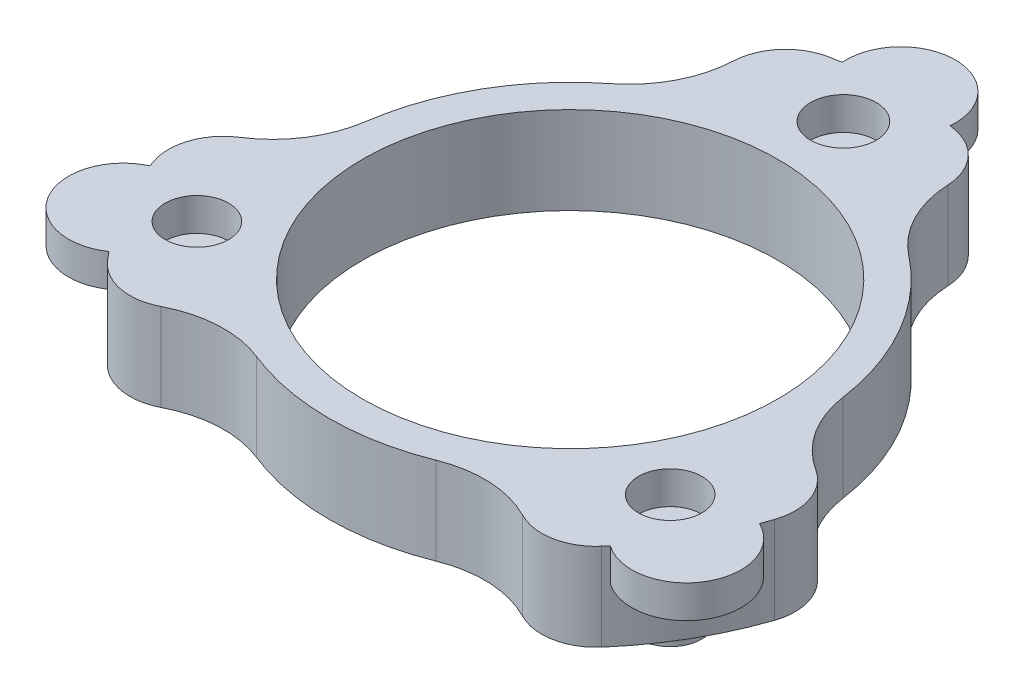
from build123d import *

# Parameters (mm, degrees)
SKETCH1_R                = 19
BOSS_EXTRUDE1_DEPTH      = 3.5
SKETCH2_R                = 30
SKETCH2_R_2              = 19
SKETCH2_R_3              = 2.8
BOSS_EXTRUDE2_DEPTH      = 8
BOSS_EXTRUDE3_DEPTH      = 2
BOSS_EXTRUDE3_DEPTH_BACK = 8
SKETCH4_R                = 2.9
SKETCH5_R                = 5
BOSS_EXTRUDE4_DEPTH      = 3
CUT_EXTRUDE1_START       = -10
SKETCH3_R                = 19
CUT_EXTRUDE1_DEPTH       = 10
SKETCH6_R                = 3
SKETCH6_R_2              = 2.9
CUT_EXTRUDE2_DEPTH       = 3
CUT_EXTRUDE3_START       = -13
CUT_EXTRUDE3_DEPTH       = 13
FILLET1_R                = 10
FILLET2_R                = 5


with BuildPart() as part:
    # Sketch1 → Boss-Extrude1 (new body)
    with BuildSketch(Plane(origin=(0, 0, 0), x_dir=(1, 0, 0), z_dir=(0, 1, 0))):
        with Locations(Location((0, 0, 0), (0, 0, 270))):
            Circle(SKETCH1_R)
    extrude(amount=BOSS_EXTRUDE1_DEPTH)

    # Sketch2 → Boss-Extrude2 (add)
    with BuildSketch(Plane(origin=(0, 0, 0), x_dir=(1, 0, 0), z_dir=(0, 1, 0))):
        with Locations(Location((0, 0, 0), (0, 0, 270))):
            Circle(SKETCH2_R)
        with Locations(Location((0, 0, 0), (0, 0, 270))):
            Circle(SKETCH2_R_2, mode=Mode.SUBTRACT)
        with Locations(Location((0, 25, 0), (0, 0, 270))):
            Circle(SKETCH2_R_3, mode=Mode.SUBTRACT)
        with Locations(Location((21.650635095, -12.5, 0), (0, 0, 270))):
            Circle(SKETCH2_R_3, mode=Mode.SUBTRACT)
        with Locations(Location((-21.650635095, -12.5, 0), (0, 0, 270))):
            Circle(SKETCH2_R_3, mode=Mode.SUBTRACT)
    extrude(amount=BOSS_EXTRUDE2_DEPTH)

    # Sketch4 → Boss-Extrude3 (add, two sides: drawn at the far end of the back side and taken through both)
    with BuildSketch(Plane.XZ.offset(-BOSS_EXTRUDE3_DEPTH_BACK)):
        with Locations(Location((-21.650635095, 12.5, 0), (0, 0, 270))):
            Circle(SKETCH4_R)
        with Locations(Location((21.650635095, 12.5, 0), (0, 0, 270))):
            Circle(SKETCH4_R)
        with Locations(Location((0, -25, 0), (0, 0, 270))):
            Circle(SKETCH4_R)
    extrude(amount=BOSS_EXTRUDE3_DEPTH + BOSS_EXTRUDE3_DEPTH_BACK)

    # Sketch5 → Boss-Extrude4 (add)
    with BuildSketch(Plane(origin=(0, 8, 0), x_dir=(1, 0, 0), z_dir=(0, 1, 0))):
        with Locations((-26.103110985, -14.7860609)):
            Circle(SKETCH5_R)
        with Locations((0.246451131, 29.99898768)):
            Circle(SKETCH5_R)
        with Locations((25.856659853, -15.212926781)):
            Circle(SKETCH5_R)
    extrude(amount=-BOSS_EXTRUDE4_DEPTH)

    # Sketch3 → Cut-Extrude1 (cut)
    with BuildSketch(Plane(origin=(0, 3.5, 0), x_dir=(1, 0, 0), z_dir=(0, 1, 0)).offset(CUT_EXTRUDE1_START)):
        with Locations(Location((0, 0, 0), (0, 0, 270))):
            Circle(SKETCH3_R)
    extrude(amount=CUT_EXTRUDE1_DEPTH, mode=Mode.SUBTRACT)

    # Sketch6 → Cut-Extrude2 (cut)
    with BuildSketch(Plane(origin=(0, 8, 0), x_dir=(1, 0, 0), z_dir=(0, 1, 0))):
        with Locations(Location((0, 25, 0), (0, 0, 270))):
            Circle(SKETCH6_R)
        with Locations(Location((21.650635095, -12.5, 0), (0, 0, 90))):
            Circle(SKETCH6_R_2)
        with Locations(Location((-21.650635095, -12.5, 0), (0, 0, 90))):
            Circle(SKETCH6_R_2)
    extrude(amount=-CUT_EXTRUDE2_DEPTH, mode=Mode.SUBTRACT)

    # Sketch7 → Cut-Extrude3 (cut)
    with BuildSketch(Plane(origin=(0, 8, 0), x_dir=(1, 0, 0), z_dir=(0, 1, 0)).offset(CUT_EXTRUDE3_START)):
        with BuildLine():
            ThreePointArc((-29.54423259, -5.20944533), (-25.980762114, 15), (-10.2606043, 28.190778624))
            Line((-10.2606043, 28.190778624), (-13.773984089, 37.84371026))
            Line((-13.773984089, 37.84371026), (-43.939319858, -7.747687605))
            Line((-43.939319858, -7.747687605), (-29.54423259, -5.20944533))
        make_face()
        with BuildLine():
            ThreePointArc((-21.729408673, -3.831481024), (-19.108521295, 11.032309914), (-7.546544436, 20.733960432))
            Line((-7.546544436, 20.733960432), (-10.2606043, 28.190778624))
            ThreePointArc((-10.2606043, 28.190778624), (-25.980762114, 15), (-29.54423259, -5.20944533))
            Line((-29.54423259, -5.20944533), (-21.729408673, -3.831481024))
        make_face()
        with BuildLine():
            Line((15.259965643, 41.926411025), (10.2606043, 28.190778624))
            ThreePointArc((10.2606043, 28.190778624), (25.980762114, 15), (29.54423259, -5.20944533))
            Line((29.54423259, -5.20944533), (39.660606503, -6.993234998))
            Line((39.660606503, -6.993234998), (15.259965643, 41.926411025))
        make_face()
        with BuildLine():
            Line((10.2606043, 28.190778624), (7.546544436, 20.733960432))
            ThreePointArc((7.546544436, 20.733960432), (18.074278438, 12.65574601), (22.064619828, 0))
            ThreePointArc((22.064619828, 0), (21.980657288, -1.92305833), (21.729408673, -3.831481024))
            Line((21.729408673, -3.831481024), (29.54423259, -5.20944533))
            ThreePointArc((29.54423259, -5.20944533), (25.980762114, 15), (10.2606043, 28.190778624))
        make_face()
        with BuildLine():
            Line((28.679354216, -34.17872342), (19.283628291, -22.981333294))
            ThreePointArc((19.283628291, -22.981333294), (0, -30), (-19.283628291, -22.981333294))
            Line((-19.283628291, -22.981333294), (-25.886622414, -30.850475262))
            Line((-25.886622414, -30.850475262), (28.679354216, -34.17872342))
        make_face()
        with BuildLine():
            Line((19.283628291, -22.981333294), (14.182864238, -16.902479408))
            ThreePointArc((14.182864238, -16.902479408), (0, -22.064619828), (-14.182864238, -16.902479408))
            Line((-14.182864238, -16.902479408), (-19.283628291, -22.981333294))
            ThreePointArc((-19.283628291, -22.981333294), (0, -30), (19.283628291, -22.981333294))
        make_face()
    extrude(amount=CUT_EXTRUDE3_DEPTH, mode=Mode.SUBTRACT)

    # Fillet1
    # the kernel refuses this fillet: 10 mm, written as the material it adds along each edge
    with BuildSketch(Plane(origin=(-21.729408673, 0, 3.831481024), x_dir=(-0.9848077530122133, 0, 0.17364817766690055), z_dir=(0, 1, 0)), Plane(origin=(14.182864238, 0, 16.902479408), x_dir=(0.6427876096865253, 0, 0.7660444431189899), z_dir=(0, 1, 0)), Plane(origin=(7.546544436, 0, -20.733960432), x_dir=(0.34202014332569675, 0, -0.9396926207858982), z_dir=(0, 1, 0))) as fillet1_piece_1:
        with BuildLine():
            CenterArc((8.404377584, -9.988996017), FILLET1_R, 92.688143309, 69.160575724)
            Line((-1.097995304, -6.873725644), (-1.288042762, -6.811420237))
            ThreePointArc((-1.288042762, -6.811420237), (-0.473724072, -3.448886874), (-0.2, 0))
            Line((-0.2, 0), (0, 0.2))
            ThreePointArc((0, 0.2), (3.967690086, 0.2), (7.926000224, 0.19977992))
            Line((7.926000224, 0.19977992), (7.935380172, 0))
        make_face()
    extrude(amount=8)
    with BuildSketch(Plane(origin=(-14.182864238, 0, 16.902479408), x_dir=(0.8578464941811706, 0, 0.5139060151633514), z_dir=(0, 1, 0)), Plane(origin=(21.729408673, 0, 3.831481024), x_dir=(0.016132417198510746, 0, -0.999869864089989), z_dir=(0, 1, 0)), Plane(origin=(-7.546544436, 0, -20.733960432), x_dir=(-0.8739789113796794, 0, 0.48596384892663586), z_dir=(0, 1, 0))) as fillet1_piece_2:
        with BuildLine():
            CenterArc((8.538251552, -9.87480959), FILLET1_R, 99.075640483, 69.160575724)
            Line((-1.251712984, -7.836036823), (-1.447512274, -7.795261367))
            ThreePointArc((-1.447512274, -7.795261367), (-0.823352684, -3.886470761), (-0.197496192, 0.03154765))
            Line((-0.197496192, 0.03154765), (0.03154765, 0.197496192))
            ThreePointArc((0.03154765, 0.197496192), (3.480434524, -0.07622788), (6.929321399, 0.197496192))
            Line((6.929321399, 0.197496192), (6.960869049, 0))
        make_face()
    extrude(amount=8)

    # Fillet2
    fillet2_edges = [part.edges().sort_by_distance(p)[0] for p in [
        (-19.283628291, 4, 22.981333294),
        (19.283628291, 4, 22.981333294),
        (29.54423259, 4, 5.20944533),
        (10.2606043, 4, -28.190778624),
        (-10.2606043, 4, -28.190778624),
        (-29.54423259, 4, 5.20944533),
    ]]
    fillet(fillet2_edges, radius=FILLET2_R)


solid = part.part
